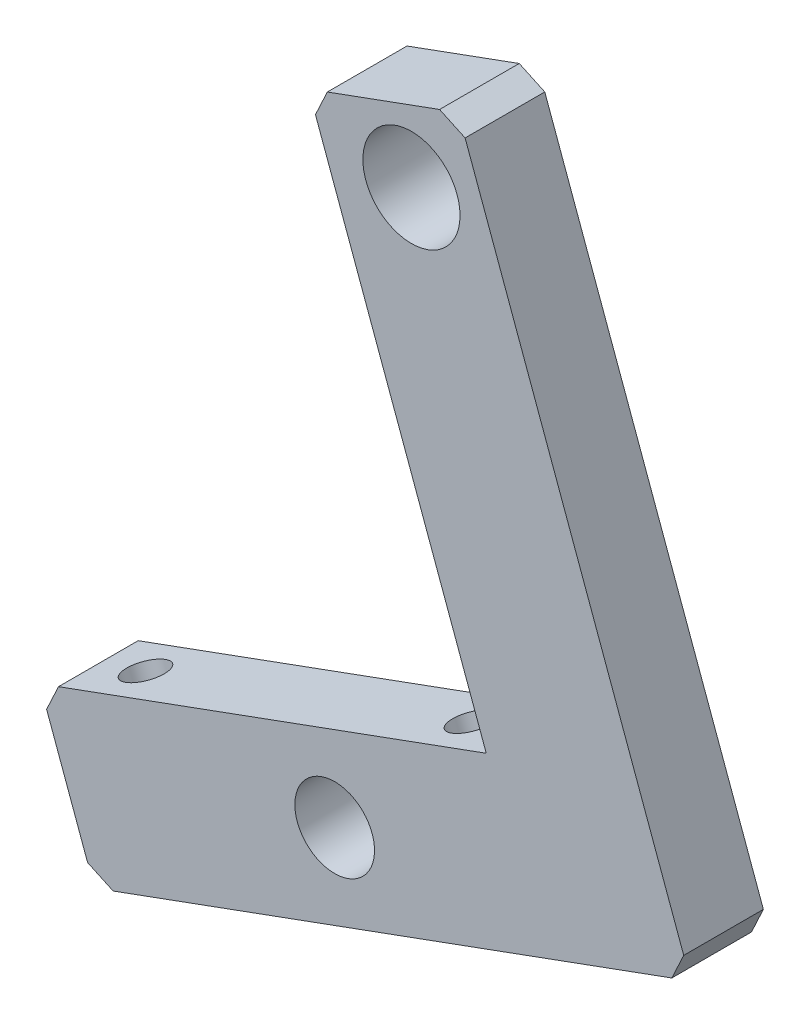
from build123d import *

# Parameters (mm, degrees)
SKETCH_1_R          = 6.1
EXTRUDE_1_DEPTH     = 10
SKETCH_2_R          = 2.5
CUT_EXTRUDE_2_DEPTH = 113.740370876
CHAMFER_1_SIZE      = 2.5
SKETCH_3_R          = 5
CUT_EXTRUDE_3_DEPTH = 127.834980714


with BuildPart() as part:
    # 草圖1 → 填料-伸長1 (new body)
    with BuildSketch(Plane.XY):
        Polygon((-29.956118011, 9.755168573), (-48.742646001, 2.894675435), (-26.446043305, -58.161540532), (-82.490240349, -78.627846462), (-75.629747212, -97.414374452), (-0.799022178, -70.087575384), align=None)
        with Locations((-35.835723415, -1.346100652)):
            Circle(SKETCH_1_R, mode=Mode.SUBTRACT)
    extrude(amount=EXTRUDE_1_DEPTH)

    # 草圖2 → 除料-伸長2 (cut, through all)
    with BuildSketch(Plane(origin=(15.628555148, -42.796674065, 0), x_dir=(0.9393263994919209, 0.3430246568652819, 0), z_dir=(-0.3430246568652819, 0.939326399491921, 0))):
        with Locations((-95.671540667, -4.982155923)):
            Circle(SKETCH_2_R)
        with Locations((-52.126292594, -4.982155923)):
            Circle(SKETCH_2_R)
    extrude(amount=-CUT_EXTRUDE_2_DEPTH, mode=Mode.SUBTRACT)

    # 導角1
    chamfer_1_edges = [part.edges().sort_by_distance(p)[0] for p in [
        (-29.956118011, 9.755168573, 5),
        (-48.742646001, 2.894675435, 5),
        (-0.799022178, -70.087575384, 5),
        (-75.629747212, -97.414374452, 5),
        (-82.490240349, -78.627846462, 5),
    ]]
    chamfer(chamfer_1_edges, length=CHAMFER_1_SIZE)

    # 草圖3 → 除料-伸長3 (cut, through all)
    with BuildSketch(Plane(origin=(0, 0, 0), x_dir=(-1, 0, 0), z_dir=(0, 0, -1))):
        with Locations((45.470290058, -75.754770876)):
            Circle(SKETCH_3_R)
    extrude(amount=-CUT_EXTRUDE_3_DEPTH, mode=Mode.SUBTRACT)


solid = part.part
